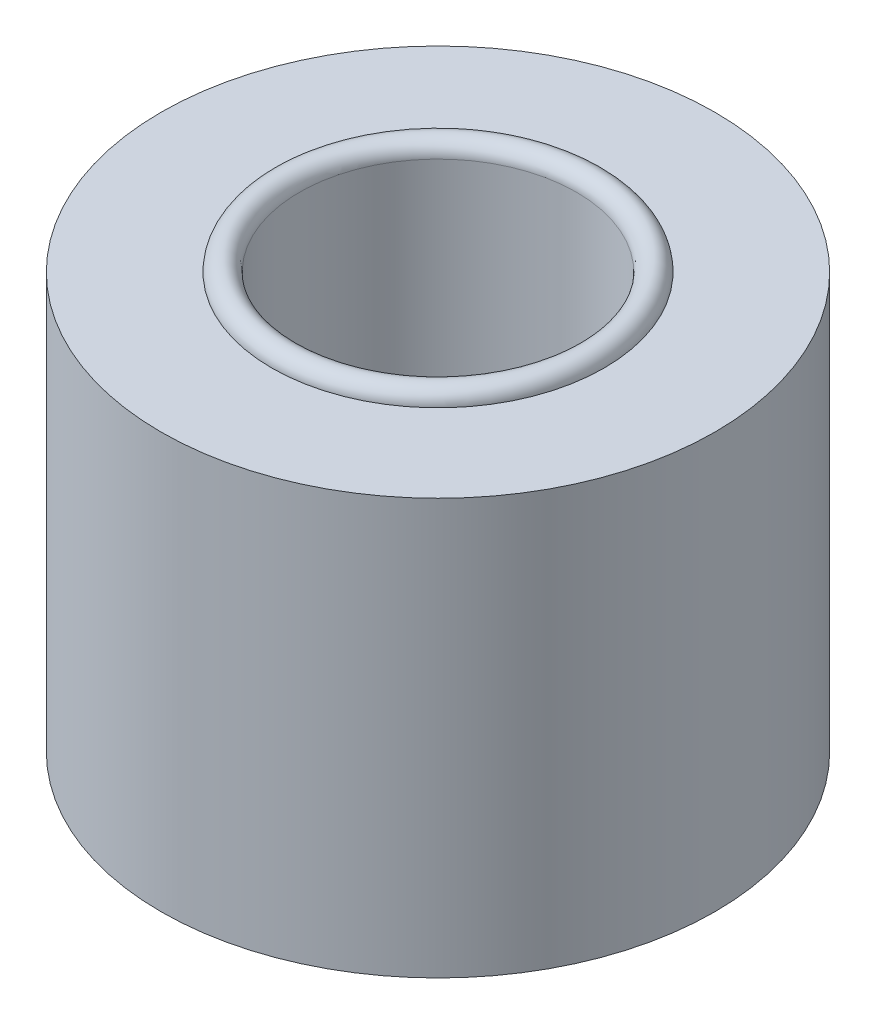
from build123d import *

# Parameters (mm, degrees)
PROFILE_SKETCH_R              = 20
PROFILE_SKETCH_R_2            = 10
PROFILE_EXTRUDE_DEPTH         = 30
RING_LIP_PROFILE_R            = 12
RING_LIP_PROFILE_R_2          = 10
TOP_RING_LIP_EXTRUDE_DEPTH    = 1
BOTTOM_START                  = -31
SKETCH2_2_R                   = 12
SKETCH2_2_R_2                 = 10
BOTTOM_RING_LIP_EXTRUDE_DEPTH = 1
TOP_RING_LIP_FILLET_R         = 1
BOTTOM_RING_LIP_FILLET_R      = 1


with BuildPart() as part:
    # Profile Sketch → Profile Extrude (new body)
    with BuildSketch(Plane(origin=(0, 0, 0), x_dir=(1, 0, 0), z_dir=(0, 1, 0))):
        with Locations(Location((0, 0, 0), (0, 0, 270))):
            Circle(PROFILE_SKETCH_R)
        with Locations(Location((0, 0, 0), (0, 0, 270))):
            Circle(PROFILE_SKETCH_R_2, mode=Mode.SUBTRACT)
    extrude(amount=PROFILE_EXTRUDE_DEPTH)

    # Ring Lip Profile → Top Ring Lip Extrude (add)
    with BuildSketch(Plane(origin=(0, 30, 0), x_dir=(1, 0, 0), z_dir=(0, 1, 0))):
        with Locations(Location((0, 0, 0), (0, 0, 270))):
            Circle(RING_LIP_PROFILE_R)
        with Locations(Location((0, 0, 0), (0, 0, 270))):
            Circle(RING_LIP_PROFILE_R_2, mode=Mode.SUBTRACT)
    extrude(amount=TOP_RING_LIP_EXTRUDE_DEPTH)

    # Sketch2<2> → Bottom Ring Lip Extrude (add)
    with BuildSketch(Plane(origin=(0, 30, 0), x_dir=(1, 0, 0), z_dir=(0, 1, 0)).offset(BOTTOM_START)):
        with Locations(Location((0, 0, 0), (0, 0, 270))):
            Circle(SKETCH2_2_R)
        with Locations(Location((0, 0, 0), (0, 0, 270))):
            Circle(SKETCH2_2_R_2, mode=Mode.SUBTRACT)
    extrude(amount=BOTTOM_RING_LIP_EXTRUDE_DEPTH)

    # Top Ring Lip Fillet
    top_ring_lip_fillet_edges = [part.edges().sort_by_distance(p)[0] for p in [
        (0, -1, -12),
        (0, -1, -10),
    ]]
    fillet(top_ring_lip_fillet_edges, radius=TOP_RING_LIP_FILLET_R - 0.0001)  # a hair under: the kernel refuses the full size

    # Bottom Ring Lip Fillet
    bottom_ring_lip_fillet_edges = [part.edges().sort_by_distance(p)[0] for p in [
        (0, 31, -12),
        (0, 31, -10),
    ]]
    fillet(bottom_ring_lip_fillet_edges, radius=BOTTOM_RING_LIP_FILLET_R - 0.0001)  # a hair under: the kernel refuses the full size


solid = part.part
